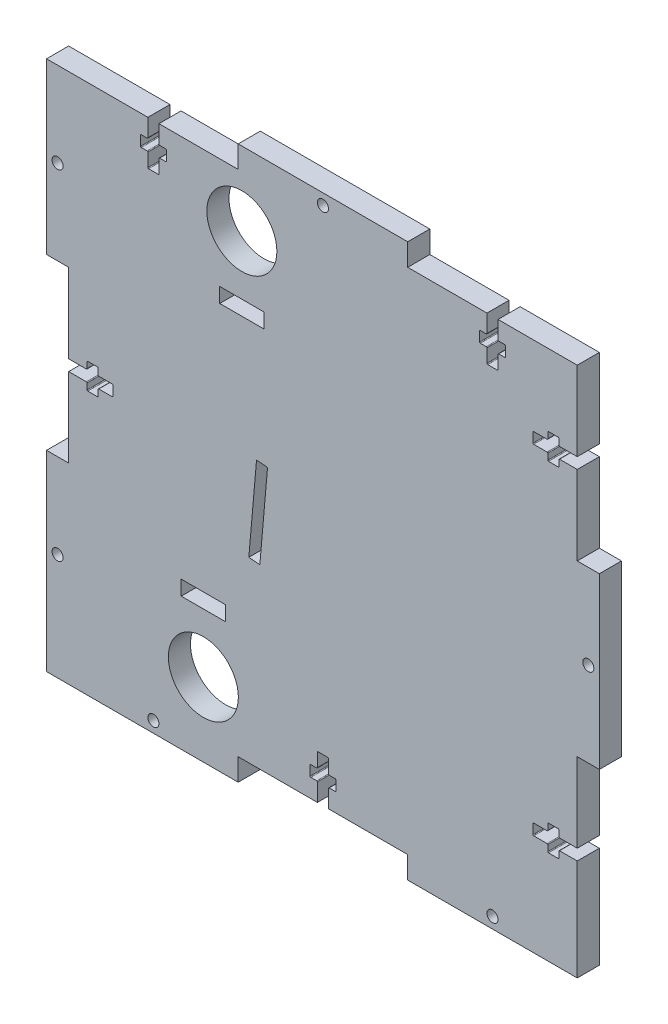
from build123d import *

# Parameters (mm, degrees)
BOX_SIDE_DEPTH       = 6
SKETCH2_R            = 1.5
SCREW_CUT_OUTS_DEPTH = 107.235587258
SKETCH3_R            = 9.5
CUT_EXTRUDE1_DEPTH   = 107.235587258
CUT_EXTRUDE2_DEPTH   = 107.235587258
SKETCH5_W            = 12
SKETCH5_H            = 4
CUT_EXTRUDE3_DEPTH   = 107.235587258


with BuildPart() as part:
    # Sketch1 → Box Side (new body)
    with BuildSketch(Plane.XY):
        Polygon((-69, 69), (-23, 69), (-23, 75), (23, 75), (23, 69), (69, 69), (69, 23), (75, 23), (75, -23), (69, -23), (69, -69), (69, -75), (23, -75), (23, -69), (-23, -69), (-23, -75), (-69, -75), (-75, -75), (-75, -69), (-75, -23), (-69, -23), (-69, 23), (-75, 23), (-75, 69), align=None)
    extrude(amount=BOX_SIDE_DEPTH)

    # Sketch2 → Screw Cut-outs (cut, through all)
    with BuildSketch(Plane.XY.offset(6)):
        with Locations((0, 72)):
            Circle(SKETCH2_R)
        with Locations((72, 0)):
            Circle(SKETCH2_R)
        with Locations((-46, -72)):
            Circle(SKETCH2_R)
        with Locations((46, -72)):
            Circle(SKETCH2_R)
        with Locations((-72, 46)):
            Circle(SKETCH2_R)
        with Locations((-72, -46)):
            Circle(SKETCH2_R)
        with BuildLine():
            Line((-44.5, 69), (-44.5, 64.2))
            ThreePointArc((-44.5, 64.2), (-44.441421356, 64.058578644), (-44.3, 64))
            Line((-44.3, 64), (-42.7, 64))
            ThreePointArc((-42.7, 64), (-42.558578644, 63.941421356), (-42.5, 63.8))
            Line((-42.5, 63.8), (-42.5, 61.2))
            ThreePointArc((-42.5, 61.2), (-42.558578644, 61.058578644), (-42.7, 61))
            Line((-42.7, 61), (-44.3, 61))
            ThreePointArc((-44.3, 61), (-44.441421356, 60.941421356), (-44.5, 60.8))
            Line((-44.5, 60.8), (-44.5, 57.2))
            ThreePointArc((-44.5, 57.2), (-44.558578644, 57.058578644), (-44.7, 57))
            Line((-44.7, 57), (-47.3, 57))
            ThreePointArc((-47.3, 57), (-47.441421356, 57.058578644), (-47.5, 57.2))
            Line((-47.5, 57.2), (-47.5, 60.8))
            ThreePointArc((-47.5, 60.8), (-47.558578644, 60.941421356), (-47.7, 61))
            Line((-47.7, 61), (-49.3, 61))
            ThreePointArc((-49.3, 61), (-49.441421356, 61.058578644), (-49.5, 61.2))
            Line((-49.5, 61.2), (-49.5, 63.8))
            ThreePointArc((-49.5, 63.8), (-49.441421356, 63.941421356), (-49.3, 64))
            Line((-49.3, 64), (-47.7, 64))
            ThreePointArc((-47.7, 64), (-47.558578644, 64.058578644), (-47.5, 64.2))
            Line((-47.5, 64.2), (-47.5, 69))
            Line((-47.5, 69), (-44.5, 69))
        make_face()
        with BuildLine():
            Line((47.5, 69), (47.5, 64.2))
            ThreePointArc((47.5, 64.2), (47.558578644, 64.058578644), (47.7, 64))
            Line((47.7, 64), (49.3, 64))
            ThreePointArc((49.3, 64), (49.441421356, 63.941421356), (49.5, 63.8))
            Line((49.5, 63.8), (49.5, 61.2))
            ThreePointArc((49.5, 61.2), (49.441421356, 61.058578644), (49.3, 61))
            Line((49.3, 61), (47.7, 61))
            ThreePointArc((47.7, 61), (47.558578644, 60.941421356), (47.5, 60.8))
            Line((47.5, 60.8), (47.5, 57.2))
            ThreePointArc((47.5, 57.2), (47.441421356, 57.058578644), (47.3, 57))
            Line((47.3, 57), (44.7, 57))
            ThreePointArc((44.7, 57), (44.558578644, 57.058578644), (44.5, 57.2))
            Line((44.5, 57.2), (44.5, 60.8))
            ThreePointArc((44.5, 60.8), (44.441421356, 60.941421356), (44.3, 61))
            Line((44.3, 61), (42.7, 61))
            ThreePointArc((42.7, 61), (42.558578644, 61.058578644), (42.5, 61.2))
            Line((42.5, 61.2), (42.5, 63.8))
            ThreePointArc((42.5, 63.8), (42.558578644, 63.941421356), (42.7, 64))
            Line((42.7, 64), (44.3, 64))
            ThreePointArc((44.3, 64), (44.441421356, 64.058578644), (44.5, 64.2))
            Line((44.5, 64.2), (44.5, 69))
            Line((44.5, 69), (47.5, 69))
        make_face()
        with BuildLine():
            Line((69, 44.5), (64.2, 44.5))
            ThreePointArc((64.2, 44.5), (64.058578644, 44.441421356), (64, 44.3))
            Line((64, 44.3), (64, 42.7))
            ThreePointArc((64, 42.7), (63.941421356, 42.558578644), (63.8, 42.5))
            Line((63.8, 42.5), (61.2, 42.5))
            ThreePointArc((61.2, 42.5), (61.058578644, 42.558578644), (61, 42.7))
            Line((61, 42.7), (61, 44.3))
            ThreePointArc((61, 44.3), (60.941421356, 44.441421356), (60.8, 44.5))
            Line((60.8, 44.5), (57.2, 44.5))
            ThreePointArc((57.2, 44.5), (57.058578644, 44.558578644), (57, 44.7))
            Line((57, 44.7), (57, 47.3))
            ThreePointArc((57, 47.3), (57.058578644, 47.441421356), (57.2, 47.5))
            Line((57.2, 47.5), (60.8, 47.5))
            ThreePointArc((60.8, 47.5), (60.941421356, 47.558578644), (61, 47.7))
            Line((61, 47.7), (61, 49.3))
            ThreePointArc((61, 49.3), (61.058578644, 49.441421356), (61.2, 49.5))
            Line((61.2, 49.5), (63.8, 49.5))
            ThreePointArc((63.8, 49.5), (63.941421356, 49.441421356), (64, 49.3))
            Line((64, 49.3), (64, 47.7))
            ThreePointArc((64, 47.7), (64.058578644, 47.558578644), (64.2, 47.5))
            Line((64.2, 47.5), (69, 47.5))
            Line((69, 47.5), (69, 44.5))
        make_face()
        with BuildLine():
            Line((69, -47.5), (64.2, -47.5))
            ThreePointArc((64.2, -47.5), (64.058578644, -47.558578644), (64, -47.7))
            Line((64, -47.7), (64, -49.3))
            ThreePointArc((64, -49.3), (63.941421356, -49.441421356), (63.8, -49.5))
            Line((63.8, -49.5), (61.2, -49.5))
            ThreePointArc((61.2, -49.5), (61.058578644, -49.441421356), (61, -49.3))
            Line((61, -49.3), (61, -47.7))
            ThreePointArc((61, -47.7), (60.941421356, -47.558578644), (60.8, -47.5))
            Line((60.8, -47.5), (57.2, -47.5))
            ThreePointArc((57.2, -47.5), (57.058578644, -47.441421356), (57, -47.3))
            Line((57, -47.3), (57, -44.7))
            ThreePointArc((57, -44.7), (57.058578644, -44.558578644), (57.2, -44.5))
            Line((57.2, -44.5), (60.8, -44.5))
            ThreePointArc((60.8, -44.5), (60.941421356, -44.441421356), (61, -44.3))
            Line((61, -44.3), (61, -42.7))
            ThreePointArc((61, -42.7), (61.058578644, -42.558578644), (61.2, -42.5))
            Line((61.2, -42.5), (63.8, -42.5))
            ThreePointArc((63.8, -42.5), (63.941421356, -42.558578644), (64, -42.7))
            Line((64, -42.7), (64, -44.3))
            ThreePointArc((64, -44.3), (64.058578644, -44.441421356), (64.2, -44.5))
            Line((64.2, -44.5), (69, -44.5))
            Line((69, -44.5), (69, -47.5))
        make_face()
        with BuildLine():
            Line((-1.5, -69), (1.5, -69))
            Line((1.5, -69), (1.5, -64.2))
            ThreePointArc((1.5, -64.2), (1.558578644, -64.058578644), (1.7, -64))
            Line((1.7, -64), (3.3, -64))
            ThreePointArc((3.3, -64), (3.441421356, -63.941421356), (3.5, -63.8))
            Line((3.5, -63.8), (3.5, -61.2))
            ThreePointArc((3.5, -61.2), (3.441421356, -61.058578644), (3.3, -61))
            Line((3.3, -61), (1.7, -61))
            ThreePointArc((1.7, -61), (1.558578644, -60.941421356), (1.5, -60.8))
            Line((1.5, -60.8), (1.5, -57.2))
            ThreePointArc((1.5, -57.2), (1.441421356, -57.058578644), (1.3, -57))
            Line((1.3, -57), (-1.3, -57))
            ThreePointArc((-1.3, -57), (-1.441421356, -57.058578644), (-1.5, -57.2))
            Line((-1.5, -57.2), (-1.5, -60.8))
            ThreePointArc((-1.5, -60.8), (-1.558578644, -60.941421356), (-1.7, -61))
            Line((-1.7, -61), (-3.3, -61))
            ThreePointArc((-3.3, -61), (-3.441421356, -61.058578644), (-3.5, -61.2))
            Line((-3.5, -61.2), (-3.5, -63.8))
            ThreePointArc((-3.5, -63.8), (-3.441421356, -63.941421356), (-3.3, -64))
            Line((-3.3, -64), (-1.7, -64))
            ThreePointArc((-1.7, -64), (-1.558578644, -64.058578644), (-1.5, -64.2))
            Line((-1.5, -64.2), (-1.5, -69))
        make_face()
        with BuildLine():
            Line((-69, -1.5), (-64.2, -1.5))
            ThreePointArc((-64.2, -1.5), (-64.058578644, -1.558578644), (-64, -1.7))
            Line((-64, -1.7), (-64, -3.3))
            ThreePointArc((-64, -3.3), (-63.941421356, -3.441421356), (-63.8, -3.5))
            Line((-63.8, -3.5), (-61.2, -3.5))
            ThreePointArc((-61.2, -3.5), (-61.058578644, -3.441421356), (-61, -3.3))
            Line((-61, -3.3), (-61, -1.7))
            ThreePointArc((-61, -1.7), (-60.941421356, -1.558578644), (-60.8, -1.5))
            Line((-60.8, -1.5), (-57.2, -1.5))
            ThreePointArc((-57.2, -1.5), (-57.058578644, -1.441421356), (-57, -1.3))
            Line((-57, -1.3), (-57, 1.3))
            ThreePointArc((-57, 1.3), (-57.058578644, 1.441421356), (-57.2, 1.5))
            Line((-57.2, 1.5), (-60.8, 1.5))
            ThreePointArc((-60.8, 1.5), (-60.941421356, 1.558578644), (-61, 1.7))
            Line((-61, 1.7), (-61, 3.3))
            ThreePointArc((-61, 3.3), (-61.058578644, 3.441421356), (-61.2, 3.5))
            Line((-61.2, 3.5), (-63.8, 3.5))
            ThreePointArc((-63.8, 3.5), (-63.941421356, 3.441421356), (-64, 3.3))
            Line((-64, 3.3), (-64, 1.7))
            ThreePointArc((-64, 1.7), (-64.058578644, 1.558578644), (-64.2, 1.5))
            Line((-64.2, 1.5), (-69, 1.5))
            Line((-69, 1.5), (-69, -1.5))
        make_face()
    extrude(amount=-SCREW_CUT_OUTS_DEPTH, mode=Mode.SUBTRACT)

    # Sketch3 → Cut-Extrude1 (cut, through all)
    with BuildSketch(Plane.XY.offset(6)):
        with Locations((-22, 55)):
            Circle(SKETCH3_R)
        with Locations((-32.45, -55)):
            Circle(SKETCH3_R)
    extrude(amount=-CUT_EXTRUDE1_DEPTH, mode=Mode.SUBTRACT)

    # Sketch4 → Cut-Extrude2 (cut, through all)
    with BuildSketch(Plane.XY.offset(6)):
        Polygon((-20.112598806, -20.696132422), (-17.124014711, -20.95759965), (-15.032276885, 2.951073104), (-18.02086098, 3.212540333), align=None)
    extrude(amount=-CUT_EXTRUDE2_DEPTH, mode=Mode.SUBTRACT)

    # Sketch5 → Cut-Extrude3 (cut, through all)
    with BuildSketch(Plane.XY.offset(6)):
        with Locations((-32.45, -37)):
            Rectangle(SKETCH5_W, SKETCH5_H)
        with Locations((-22, 37)):
            Rectangle(SKETCH5_W, SKETCH5_H)
    extrude(amount=-CUT_EXTRUDE3_DEPTH, mode=Mode.SUBTRACT)


solid = part.part
